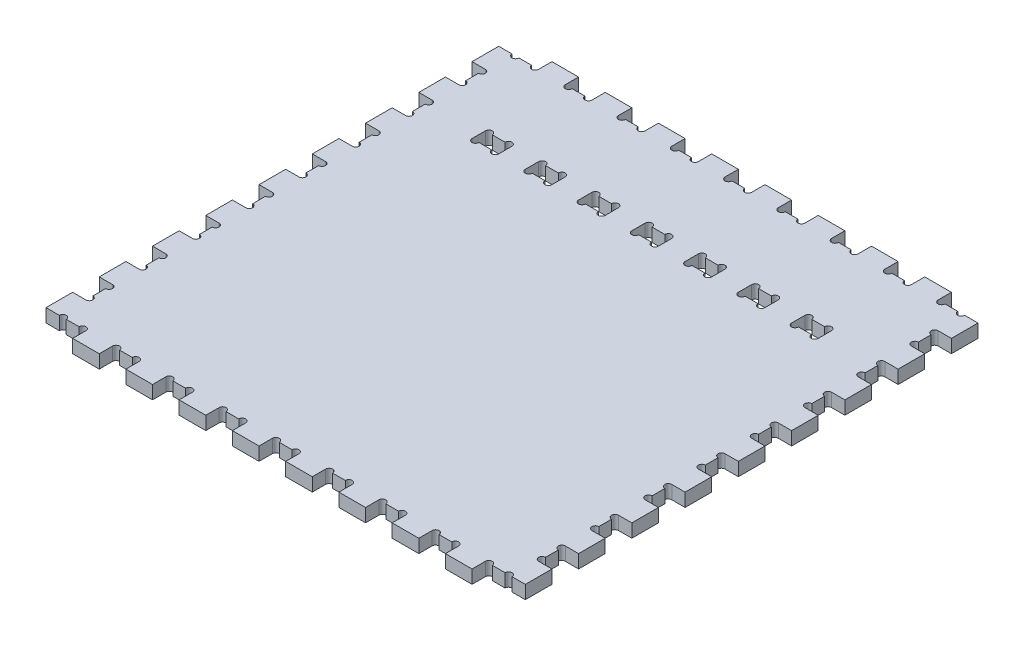
from build123d import *

# Parameters (mm, degrees)
SKETCH1_W               = 457.2
SKETCH1_H               = 457.2
BOSS_EXTRUDE1_DEPTH     = 12.7
CUT_EXTRUDE1_DEPTH      = 12.7
LPATTERN1_COUNT         = 9
LPATTERN1_PITCH         = 50.8
MIRROR1_COPY_1_DEPTH    = 12.7
MIRROR1_COPY_2_DEPTH    = 12.7
MIRROR1_COPY_3_DEPTH    = 12.7
MIRROR1_COPY_4_DEPTH    = 12.7
MIRROR1_COPY_5_DEPTH    = 12.7
MIRROR1_COPY_6_DEPTH    = 12.7
MIRROR1_COPY_7_DEPTH    = 12.7
MIRROR1_COPY_8_DEPTH    = 12.7
MIRROR1_COPY_9_DEPTH    = 12.7
SKETCH3_W               = 12.7
SKETCH3_H               = 12.7
CUT_EXTRUDE2_DEPTH      = 324.538575753
MIRROR3_COPY_1_SKETCH_W = 12.7
MIRROR3_COPY_1_SKETCH_H = 12.7
MIRROR3_COPY_1_DEPTH    = 324.538575753
MIRROR3_COPY_2_SKETCH_W = 12.7
MIRROR3_COPY_2_SKETCH_H = 12.7
MIRROR3_COPY_2_DEPTH    = 324.538575753
CUT_EXTRUDE3_DEPTH      = 324.538575753
LPATTERN2_COUNT         = 9
LPATTERN2_PITCH         = 50.8
MIRROR4_COPY_1_DEPTH    = 324.538575753
MIRROR4_COPY_2_DEPTH    = 324.538575753
MIRROR4_COPY_3_DEPTH    = 324.538575753
MIRROR4_COPY_4_DEPTH    = 324.538575753
MIRROR4_COPY_5_DEPTH    = 324.538575753
MIRROR4_COPY_6_DEPTH    = 324.538575753
MIRROR4_COPY_7_DEPTH    = 324.538575753
MIRROR4_COPY_8_DEPTH    = 324.538575753
MIRROR4_COPY_9_DEPTH    = 324.538575753
CUT_EXTRUDE4_DEPTH      = 324.538575753
LPATTERN3_COUNT         = 7
LPATTERN3_PITCH         = 50.8


with BuildPart() as part:
    # Sketch1 → Boss-Extrude1 (new body)
    with BuildSketch(Plane(origin=(0, 0, 0), x_dir=(1, 0, 0), z_dir=(0, 1, 0))):
        Rectangle(SKETCH1_W, SKETCH1_H)
    extrude(amount=BOSS_EXTRUDE1_DEPTH)

    # Sketch2 → Cut-Extrude1 (cut)
    with BuildSketch(Plane(origin=(0, 12.7, 0), x_dir=(1, 0, 0), z_dir=(0, 1, 0))):
        with BuildLine():
            Line((-190.5, 228.6), (-215.9, 228.6))
            Line((-215.9, 228.6), (-215.9, 215.9))
            ThreePointArc((-215.9, 215.9), (-212.598, 212.598), (-209.296, 215.9))
            Line((-209.296, 215.9), (-197.104, 215.9))
            ThreePointArc((-197.104, 215.9), (-193.802, 212.598), (-190.5, 215.9))
            Line((-190.5, 215.9), (-190.5, 228.6))
        make_face()
    cut_extrude1 = extrude(amount=-CUT_EXTRUDE1_DEPTH, mode=Mode.SUBTRACT)

    # LPattern1: Cut-Extrude1 ×9
    with Locations(*[(i * LPATTERN1_PITCH, 0, 0) for i in range(1, LPATTERN1_COUNT)]):
        add(cut_extrude1, mode=Mode.SUBTRACT)

    # Mirror1 copy 1 sketch → Mirror1 copy 1 (cut)
    with BuildSketch(Plane(origin=(50.8, 12.7, 0), x_dir=(1, 0, 0), z_dir=(0, 1, 0))):
        with BuildLine():
            Line((-190.5, -228.6), (-215.9, -228.6))
            Line((-215.9, -228.6), (-215.9, -215.9))
            ThreePointArc((-215.9, -215.9), (-212.598, -212.598), (-209.296, -215.9))
            Line((-209.296, -215.9), (-197.104, -215.9))
            ThreePointArc((-197.104, -215.9), (-193.802, -212.598), (-190.5, -215.9))
            Line((-190.5, -215.9), (-190.5, -228.6))
        make_face()
    extrude(amount=-MIRROR1_COPY_1_DEPTH, mode=Mode.SUBTRACT)

    # Mirror1 copy 2 sketch → Mirror1 copy 2 (cut)
    with BuildSketch(Plane(origin=(101.6, 12.7, 0), x_dir=(1, 0, 0), z_dir=(0, 1, 0))):
        with BuildLine():
            Line((-190.5, -228.6), (-215.9, -228.6))
            Line((-215.9, -228.6), (-215.9, -215.9))
            ThreePointArc((-215.9, -215.9), (-212.598, -212.598), (-209.296, -215.9))
            Line((-209.296, -215.9), (-197.104, -215.9))
            ThreePointArc((-197.104, -215.9), (-193.802, -212.598), (-190.5, -215.9))
            Line((-190.5, -215.9), (-190.5, -228.6))
        make_face()
    extrude(amount=-MIRROR1_COPY_2_DEPTH, mode=Mode.SUBTRACT)

    # Mirror1 copy 3 sketch → Mirror1 copy 3 (cut)
    with BuildSketch(Plane(origin=(152.4, 12.7, 0), x_dir=(1, 0, 0), z_dir=(0, 1, 0))):
        with BuildLine():
            Line((-190.5, -228.6), (-215.9, -228.6))
            Line((-215.9, -228.6), (-215.9, -215.9))
            ThreePointArc((-215.9, -215.9), (-212.598, -212.598), (-209.296, -215.9))
            Line((-209.296, -215.9), (-197.104, -215.9))
            ThreePointArc((-197.104, -215.9), (-193.802, -212.598), (-190.5, -215.9))
            Line((-190.5, -215.9), (-190.5, -228.6))
        make_face()
    extrude(amount=-MIRROR1_COPY_3_DEPTH, mode=Mode.SUBTRACT)

    # Mirror1 copy 4 sketch → Mirror1 copy 4 (cut)
    with BuildSketch(Plane(origin=(203.2, 12.7, 0), x_dir=(1, 0, 0), z_dir=(0, 1, 0))):
        with BuildLine():
            Line((-190.5, -228.6), (-215.9, -228.6))
            Line((-215.9, -228.6), (-215.9, -215.9))
            ThreePointArc((-215.9, -215.9), (-212.598, -212.598), (-209.296, -215.9))
            Line((-209.296, -215.9), (-197.104, -215.9))
            ThreePointArc((-197.104, -215.9), (-193.802, -212.598), (-190.5, -215.9))
            Line((-190.5, -215.9), (-190.5, -228.6))
        make_face()
    extrude(amount=-MIRROR1_COPY_4_DEPTH, mode=Mode.SUBTRACT)

    # Mirror1 copy 5 sketch → Mirror1 copy 5 (cut)
    with BuildSketch(Plane(origin=(254, 12.7, 0), x_dir=(1, 0, 0), z_dir=(0, 1, 0))):
        with BuildLine():
            Line((-190.5, -228.6), (-215.9, -228.6))
            Line((-215.9, -228.6), (-215.9, -215.9))
            ThreePointArc((-215.9, -215.9), (-212.598, -212.598), (-209.296, -215.9))
            Line((-209.296, -215.9), (-197.104, -215.9))
            ThreePointArc((-197.104, -215.9), (-193.802, -212.598), (-190.5, -215.9))
            Line((-190.5, -215.9), (-190.5, -228.6))
        make_face()
    extrude(amount=-MIRROR1_COPY_5_DEPTH, mode=Mode.SUBTRACT)

    # Mirror1 copy 6 sketch → Mirror1 copy 6 (cut)
    with BuildSketch(Plane(origin=(304.8, 12.7, 0), x_dir=(1, 0, 0), z_dir=(0, 1, 0))):
        with BuildLine():
            Line((-190.5, -228.6), (-215.9, -228.6))
            Line((-215.9, -228.6), (-215.9, -215.9))
            ThreePointArc((-215.9, -215.9), (-212.598, -212.598), (-209.296, -215.9))
            Line((-209.296, -215.9), (-197.104, -215.9))
            ThreePointArc((-197.104, -215.9), (-193.802, -212.598), (-190.5, -215.9))
            Line((-190.5, -215.9), (-190.5, -228.6))
        make_face()
    extrude(amount=-MIRROR1_COPY_6_DEPTH, mode=Mode.SUBTRACT)

    # Mirror1 copy 7 sketch → Mirror1 copy 7 (cut)
    with BuildSketch(Plane(origin=(355.6, 12.7, 0), x_dir=(1, 0, 0), z_dir=(0, 1, 0))):
        with BuildLine():
            Line((-190.5, -228.6), (-215.9, -228.6))
            Line((-215.9, -228.6), (-215.9, -215.9))
            ThreePointArc((-215.9, -215.9), (-212.598, -212.598), (-209.296, -215.9))
            Line((-209.296, -215.9), (-197.104, -215.9))
            ThreePointArc((-197.104, -215.9), (-193.802, -212.598), (-190.5, -215.9))
            Line((-190.5, -215.9), (-190.5, -228.6))
        make_face()
    extrude(amount=-MIRROR1_COPY_7_DEPTH, mode=Mode.SUBTRACT)

    # Mirror1 copy 8 sketch → Mirror1 copy 8 (cut)
    with BuildSketch(Plane(origin=(406.4, 12.7, 0), x_dir=(1, 0, 0), z_dir=(0, 1, 0))):
        with BuildLine():
            Line((-190.5, -228.6), (-215.9, -228.6))
            Line((-215.9, -228.6), (-215.9, -215.9))
            ThreePointArc((-215.9, -215.9), (-212.598, -212.598), (-209.296, -215.9))
            Line((-209.296, -215.9), (-197.104, -215.9))
            ThreePointArc((-197.104, -215.9), (-193.802, -212.598), (-190.5, -215.9))
            Line((-190.5, -215.9), (-190.5, -228.6))
        make_face()
    extrude(amount=-MIRROR1_COPY_8_DEPTH, mode=Mode.SUBTRACT)

    # Mirror1 copy 9 sketch → Mirror1 copy 9 (cut)
    with BuildSketch(Plane(origin=(0, 12.7, 0), x_dir=(1, 0, 0), z_dir=(0, 1, 0))):
        with BuildLine():
            Line((-190.5, -228.6), (-215.9, -228.6))
            Line((-215.9, -228.6), (-215.9, -215.9))
            ThreePointArc((-215.9, -215.9), (-212.598, -212.598), (-209.296, -215.9))
            Line((-209.296, -215.9), (-197.104, -215.9))
            ThreePointArc((-197.104, -215.9), (-193.802, -212.598), (-190.5, -215.9))
            Line((-190.5, -215.9), (-190.5, -228.6))
        make_face()
    extrude(amount=-MIRROR1_COPY_9_DEPTH, mode=Mode.SUBTRACT)

    # Sketch3 → Cut-Extrude2 (cut, through all)
    with BuildSketch(Plane(origin=(0, 12.7, 0), x_dir=(1, 0, 0), z_dir=(0, 1, 0))):
        with Locations((-222.25, 222.25)):
            Rectangle(SKETCH3_W, SKETCH3_H)
    cut_extrude2 = extrude(amount=-CUT_EXTRUDE2_DEPTH, mode=Mode.SUBTRACT)

    # Mirror2: Cut-Extrude2 across plane
    add(cut_extrude2.mirror(Plane.ZY), mode=Mode.SUBTRACT)

    # Mirror3 copy 1 sketch → Mirror3 copy 1 (cut, through all)
    with BuildSketch(Plane(origin=(0, 12.7, 0), x_dir=(-1, 0, 0), z_dir=(0, 1, 0))):
        with Locations((-222.25, 222.25)):
            Rectangle(MIRROR3_COPY_1_SKETCH_W, MIRROR3_COPY_1_SKETCH_H)
    extrude(amount=-MIRROR3_COPY_1_DEPTH, mode=Mode.SUBTRACT)

    # Mirror3 copy 2 sketch → Mirror3 copy 2 (cut, through all)
    with BuildSketch(Plane(origin=(0, 12.7, 0), x_dir=(1, 0, 0), z_dir=(0, 1, 0))):
        with Locations((-222.25, -222.25)):
            Rectangle(MIRROR3_COPY_2_SKETCH_W, MIRROR3_COPY_2_SKETCH_H)
    extrude(amount=-MIRROR3_COPY_2_DEPTH, mode=Mode.SUBTRACT)

    # Sketch4 → Cut-Extrude3 (cut, through all)
    with BuildSketch(Plane(origin=(0, 12.7, 0), x_dir=(1, 0, 0), z_dir=(0, 1, 0))):
        with BuildLine():
            Line((-215.9, 190.5), (-228.6, 190.5))
            Line((-228.6, 190.5), (-228.6, 165.1))
            Line((-228.6, 165.1), (-215.9, 165.1))
            ThreePointArc((-215.9, 165.1), (-212.598, 168.402), (-215.9, 171.704))
            Line((-215.9, 171.704), (-215.9, 183.896))
            ThreePointArc((-215.9, 183.896), (-212.598, 187.198), (-215.9, 190.5))
        make_face()
    cut_extrude3 = extrude(amount=-CUT_EXTRUDE3_DEPTH, mode=Mode.SUBTRACT)

    # LPattern2: Cut-Extrude3 ×9
    with Locations(*[(0, 0, i * LPATTERN2_PITCH) for i in range(1, LPATTERN2_COUNT)]):
        add(cut_extrude3, mode=Mode.SUBTRACT)

    # Mirror4 copy 1 sketch → Mirror4 copy 1 (cut, through all)
    with BuildSketch(Plane(origin=(0, 12.7, 50.8), x_dir=(-1, 0, 0), z_dir=(0, 1, 0))):
        with BuildLine():
            Line((-215.9, -190.5), (-228.6, -190.5))
            Line((-228.6, -190.5), (-228.6, -165.1))
            Line((-228.6, -165.1), (-215.9, -165.1))
            ThreePointArc((-215.9, -165.1), (-212.598, -168.402), (-215.9, -171.704))
            Line((-215.9, -171.704), (-215.9, -183.896))
            ThreePointArc((-215.9, -183.896), (-212.598, -187.198), (-215.9, -190.5))
        make_face()
    extrude(amount=-MIRROR4_COPY_1_DEPTH, mode=Mode.SUBTRACT)

    # Mirror4 copy 2 sketch → Mirror4 copy 2 (cut, through all)
    with BuildSketch(Plane(origin=(0, 12.7, 101.6), x_dir=(-1, 0, 0), z_dir=(0, 1, 0))):
        with BuildLine():
            Line((-215.9, -190.5), (-228.6, -190.5))
            Line((-228.6, -190.5), (-228.6, -165.1))
            Line((-228.6, -165.1), (-215.9, -165.1))
            ThreePointArc((-215.9, -165.1), (-212.598, -168.402), (-215.9, -171.704))
            Line((-215.9, -171.704), (-215.9, -183.896))
            ThreePointArc((-215.9, -183.896), (-212.598, -187.198), (-215.9, -190.5))
        make_face()
    extrude(amount=-MIRROR4_COPY_2_DEPTH, mode=Mode.SUBTRACT)

    # Mirror4 copy 3 sketch → Mirror4 copy 3 (cut, through all)
    with BuildSketch(Plane(origin=(0, 12.7, 152.4), x_dir=(-1, 0, 0), z_dir=(0, 1, 0))):
        with BuildLine():
            Line((-215.9, -190.5), (-228.6, -190.5))
            Line((-228.6, -190.5), (-228.6, -165.1))
            Line((-228.6, -165.1), (-215.9, -165.1))
            ThreePointArc((-215.9, -165.1), (-212.598, -168.402), (-215.9, -171.704))
            Line((-215.9, -171.704), (-215.9, -183.896))
            ThreePointArc((-215.9, -183.896), (-212.598, -187.198), (-215.9, -190.5))
        make_face()
    extrude(amount=-MIRROR4_COPY_3_DEPTH, mode=Mode.SUBTRACT)

    # Mirror4 copy 4 sketch → Mirror4 copy 4 (cut, through all)
    with BuildSketch(Plane(origin=(0, 12.7, 203.2), x_dir=(-1, 0, 0), z_dir=(0, 1, 0))):
        with BuildLine():
            Line((-215.9, -190.5), (-228.6, -190.5))
            Line((-228.6, -190.5), (-228.6, -165.1))
            Line((-228.6, -165.1), (-215.9, -165.1))
            ThreePointArc((-215.9, -165.1), (-212.598, -168.402), (-215.9, -171.704))
            Line((-215.9, -171.704), (-215.9, -183.896))
            ThreePointArc((-215.9, -183.896), (-212.598, -187.198), (-215.9, -190.5))
        make_face()
    extrude(amount=-MIRROR4_COPY_4_DEPTH, mode=Mode.SUBTRACT)

    # Mirror4 copy 5 sketch → Mirror4 copy 5 (cut, through all)
    with BuildSketch(Plane(origin=(0, 12.7, 254), x_dir=(-1, 0, 0), z_dir=(0, 1, 0))):
        with BuildLine():
            Line((-215.9, -190.5), (-228.6, -190.5))
            Line((-228.6, -190.5), (-228.6, -165.1))
            Line((-228.6, -165.1), (-215.9, -165.1))
            ThreePointArc((-215.9, -165.1), (-212.598, -168.402), (-215.9, -171.704))
            Line((-215.9, -171.704), (-215.9, -183.896))
            ThreePointArc((-215.9, -183.896), (-212.598, -187.198), (-215.9, -190.5))
        make_face()
    extrude(amount=-MIRROR4_COPY_5_DEPTH, mode=Mode.SUBTRACT)

    # Mirror4 copy 6 sketch → Mirror4 copy 6 (cut, through all)
    with BuildSketch(Plane(origin=(0, 12.7, 304.8), x_dir=(-1, 0, 0), z_dir=(0, 1, 0))):
        with BuildLine():
            Line((-215.9, -190.5), (-228.6, -190.5))
            Line((-228.6, -190.5), (-228.6, -165.1))
            Line((-228.6, -165.1), (-215.9, -165.1))
            ThreePointArc((-215.9, -165.1), (-212.598, -168.402), (-215.9, -171.704))
            Line((-215.9, -171.704), (-215.9, -183.896))
            ThreePointArc((-215.9, -183.896), (-212.598, -187.198), (-215.9, -190.5))
        make_face()
    extrude(amount=-MIRROR4_COPY_6_DEPTH, mode=Mode.SUBTRACT)

    # Mirror4 copy 7 sketch → Mirror4 copy 7 (cut, through all)
    with BuildSketch(Plane(origin=(0, 12.7, 355.6), x_dir=(-1, 0, 0), z_dir=(0, 1, 0))):
        with BuildLine():
            Line((-215.9, -190.5), (-228.6, -190.5))
            Line((-228.6, -190.5), (-228.6, -165.1))
            Line((-228.6, -165.1), (-215.9, -165.1))
            ThreePointArc((-215.9, -165.1), (-212.598, -168.402), (-215.9, -171.704))
            Line((-215.9, -171.704), (-215.9, -183.896))
            ThreePointArc((-215.9, -183.896), (-212.598, -187.198), (-215.9, -190.5))
        make_face()
    extrude(amount=-MIRROR4_COPY_7_DEPTH, mode=Mode.SUBTRACT)

    # Mirror4 copy 8 sketch → Mirror4 copy 8 (cut, through all)
    with BuildSketch(Plane(origin=(0, 12.7, 406.4), x_dir=(-1, 0, 0), z_dir=(0, 1, 0))):
        with BuildLine():
            Line((-215.9, -190.5), (-228.6, -190.5))
            Line((-228.6, -190.5), (-228.6, -165.1))
            Line((-228.6, -165.1), (-215.9, -165.1))
            ThreePointArc((-215.9, -165.1), (-212.598, -168.402), (-215.9, -171.704))
            Line((-215.9, -171.704), (-215.9, -183.896))
            ThreePointArc((-215.9, -183.896), (-212.598, -187.198), (-215.9, -190.5))
        make_face()
    extrude(amount=-MIRROR4_COPY_8_DEPTH, mode=Mode.SUBTRACT)

    # Mirror4 copy 9 sketch → Mirror4 copy 9 (cut, through all)
    with BuildSketch(Plane(origin=(0, 12.7, 0), x_dir=(-1, 0, 0), z_dir=(0, 1, 0))):
        with BuildLine():
            Line((-215.9, -190.5), (-228.6, -190.5))
            Line((-228.6, -190.5), (-228.6, -165.1))
            Line((-228.6, -165.1), (-215.9, -165.1))
            ThreePointArc((-215.9, -165.1), (-212.598, -168.402), (-215.9, -171.704))
            Line((-215.9, -171.704), (-215.9, -183.896))
            ThreePointArc((-215.9, -183.896), (-212.598, -187.198), (-215.9, -190.5))
        make_face()
    extrude(amount=-MIRROR4_COPY_9_DEPTH, mode=Mode.SUBTRACT)

    # Sketch5 → Cut-Extrude4 (cut, through all)
    with BuildSketch(Plane(origin=(0, 12.7, 0), x_dir=(1, 0, 0), z_dir=(0, 1, 0))):
        with BuildLine():
            ThreePointArc((-158.496, 139.7), (-161.798, 143.002), (-165.1, 139.7))
            Line((-165.1, 139.7), (-165.1, 127))
            ThreePointArc((-165.1, 127), (-161.798, 123.698), (-158.496, 127))
            Line((-158.496, 127), (-146.304, 127))
            ThreePointArc((-146.304, 127), (-143.002, 123.698), (-139.7, 127))
            Line((-139.7, 127), (-139.7, 139.7))
            ThreePointArc((-139.7, 139.7), (-143.002, 143.002), (-146.304, 139.7))
            Line((-146.304, 139.7), (-158.496, 139.7))
        make_face()
    cut_extrude4 = extrude(amount=-CUT_EXTRUDE4_DEPTH, mode=Mode.SUBTRACT)

    # LPattern3: Cut-Extrude4 ×7
    with Locations(*[(i * LPATTERN3_PITCH, 0, 0) for i in range(1, LPATTERN3_COUNT)]):
        add(cut_extrude4, mode=Mode.SUBTRACT)


solid = part.part
